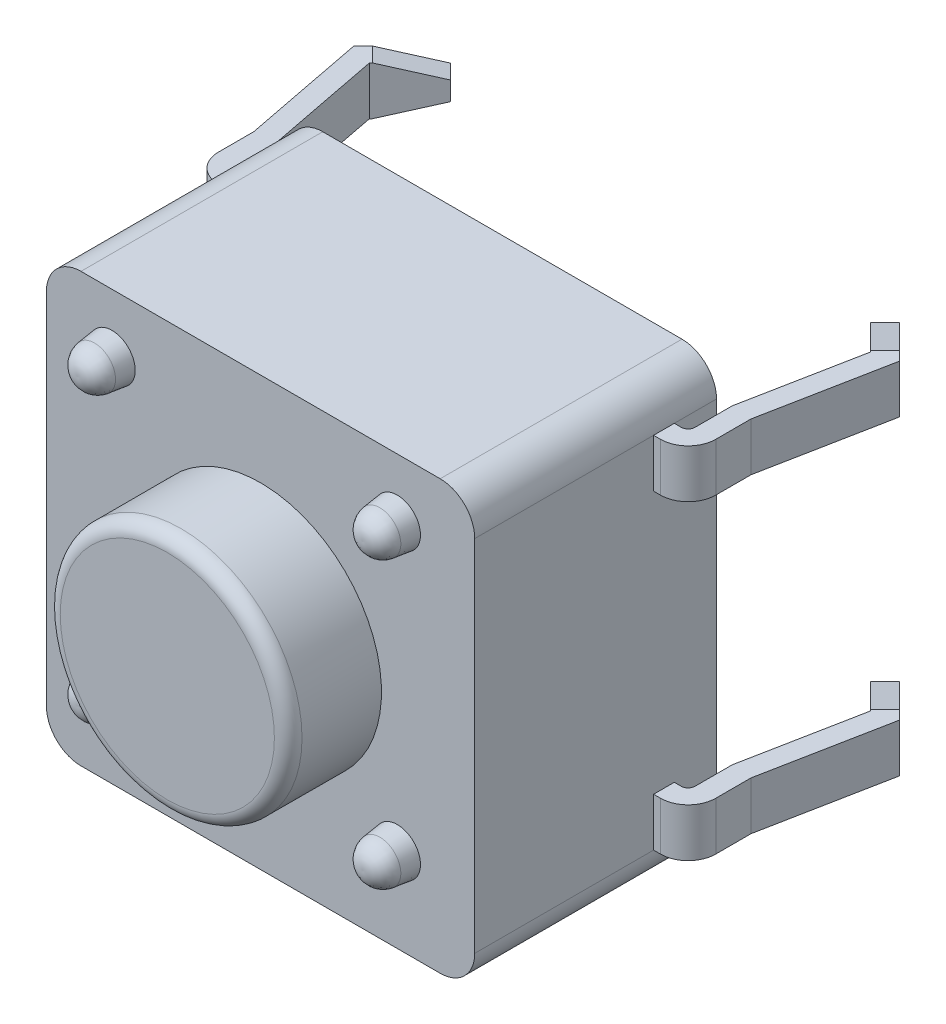
from build123d import *
from OCP.BRepFilletAPI import BRepFilletAPI_MakeChamfer

# Parameters (mm, degrees)
SKETCH1_W                 = 6.2
SKETCH1_H                 = 6.2
EXTRUDE1_DEPTH            = 3.5
SKETCH2_R                 = 1.75
EXTRUDE2_DEPTH            = 1.35
LPATTERN1_COUNT           = 2
LPATTERN1_PITCH           = 4.13
LPATTERN1_COUNT_DIR2      = 2
LPATTERN1_PITCH_DIR2      = 4.13
FILLET1_R                 = 0.5
FILLET2_R                 = 0.2
EXTRUDE3_DEPTH            = 0.35
CHAMFER1_SIZE             = 0.8
CHAMFER1_SIZE2            = 0.214359354
CHAMFER1_OF_MIRROR1_SIZE  = 0.8
CHAMFER1_OF_MIRROR1_SIZE2 = 0.214359354
MIRROR2_START             = -2.6
MIRROR2_DEPTH             = 0.7
MIRROR2_START_2           = 1.9
MIRROR2_2_DEPTH           = 0.7
MIRROR2_START_3           = 3.765863992
MIRROR2_3_DEPTH           = 0.3


with BuildPart() as part:
    # Sketch1 → Extrude1 (new body)
    with BuildSketch(Plane.XY):
        Rectangle(SKETCH1_W, SKETCH1_H)
    extrude(amount=EXTRUDE1_DEPTH)

    # Sketch2 → Extrude2 (add)
    with BuildSketch(Plane.XY.offset(3.5)):
        with Locations(Location((0, 0, 0), (0, 0, 180))):
            Circle(SKETCH2_R)
    extrude(amount=EXTRUDE2_DEPTH)

    # Sketch4 → Revolve1 (revolve)
    with BuildSketch(Plane(origin=(0, 2.25, 0), x_dir=(-1, 0, 0), z_dir=(0, 1, 0)), mode=Mode.PRIVATE) as revolve1_sk:
        with BuildLine():
            Line((1.815270458, 3.5), (2.15, 3.5))
            Line((2.15, 3.5), (2.15, 4))
            ThreePointArc((2.15, 4), (1.948488877, 3.937944347), (1.846391659, 3.753461841))
            Line((1.846391659, 3.753461841), (1.815270458, 3.5))
        make_face()
    revolve1 = revolve(revolve1_sk.sketch.rotate(Axis((-2.15, 2.25, 2.844368125), (0, 0, 1)), 180), axis=Axis((-2.15, 2.25, 2.844368125), (0, 0, 1)))

    # LPattern1: Revolve1 2 × 2
    with Locations(*[(i * LPATTERN1_PITCH, -j * LPATTERN1_PITCH_DIR2, 0) for i in range(LPATTERN1_COUNT) for j in range(LPATTERN1_COUNT_DIR2) if (i, j) != (0, 0)]):
        add(revolve1)

    # Fillet1
    fillet1_edges = [part.edges().sort_by_distance(p)[0] for p in [
        (-3.1, 3.1, 1.75),
        (3.1, 3.1, 1.75),
        (3.1, -3.1, 1.75),
        (-3.1, -3.1, 1.75),
    ]]
    fillet(fillet1_edges, radius=FILLET1_R)

    # Fillet2
    fillet2_edges = [part.edges().sort_by_distance(p)[0] for p in [
        (1.75, 0, 4.85),
    ]]
    fillet(fillet2_edges, radius=FILLET2_R)

    # Sketch5 → Extrude3 (add, symmetric)
    with BuildSketch(Plane(origin=(0, 2.25, 0), x_dir=(-1, 0, 0), z_dir=(0, 1, 0))):
        with BuildLine():
            Line((3.1, 0.91088803), (3.2, 0.91088803))
            ThreePointArc((3.2, 0.91088803), (3.482842712, 0.793730742), (3.6, 0.51088803))
            Line((3.6, 0.51088803), (3.6, 0))
            Line((3.6, 0), (3.95, -1.8))
            Line((3.95, -1.8), (3.25, -2.5))
            Line((3.25, -2.5), (3.037867966, -2.287867966))
            Line((3.037867966, -2.287867966), (3.625066954, -1.700668977))
            Line((3.625066954, -1.700668977), (3.3, -0.02889607))
            Line((3.3, -0.02889607), (3.3, 0.51088803))
            ThreePointArc((3.3, 0.51088803), (3.270710678, 0.581598708), (3.2, 0.61088803))
            Line((3.2, 0.61088803), (3.1, 0.61088803))
            Line((3.1, 0.61088803), (3.1, 0.91088803))
        make_face()
    extrude3 = extrude(amount=EXTRUDE3_DEPTH, both=True)

    # Chamfer1: one chamfer whose edges measure the first distance from different faces: ONE call of the kernel's chamfer builder (chamfer() names one face for all edges)
    chamfer1_edges_1 = [part.edges().sort_by_distance(p)[0] for p in [
        (-3.143933983, 1.9, -2.393933983),
    ]]
    chamfer1_side_1 = [part.faces().sort_by_distance(p)[0] for p in [
        (-3.520562137, 1.9, -0.80393009),
    ]]
    chamfer1_edges_2 = [part.edges().sort_by_distance(p)[0] for p in [
        (-3.143933983, 2.6, -2.393933983),
    ]]
    chamfer1_side_2 = [part.faces().sort_by_distance(p)[0] for p in [
        (-3.520562137, 2.6, -0.80393009),
    ]]
    chamfer1 = BRepFilletAPI_MakeChamfer(part.part.solid().wrapped)
    for e in chamfer1_edges_1:
        chamfer1.Add(CHAMFER1_SIZE, CHAMFER1_SIZE2, e.wrapped, chamfer1_side_1[0].wrapped)  # the first distance lies on this face
    for e in chamfer1_edges_2:
        chamfer1.Add(CHAMFER1_SIZE, CHAMFER1_SIZE2, e.wrapped, chamfer1_side_2[0].wrapped)  # the first distance lies on this face
    add(Compound.cast(chamfer1.Shape()), mode=Mode.REPLACE)

    # Mirror1: Extrude3 across plane
    add(extrude3.mirror(Plane.ZX))

    # Chamfer1 of Mirror1: one chamfer whose edges measure the first distance from different faces: ONE call of the kernel's chamfer builder (chamfer() names one face for all edges)
    chamfer1_of_mirror1_edges_1 = [part.edges().sort_by_distance(p)[0] for p in [
        (-3.143933983, -1.9, -2.393933983),
    ]]
    chamfer1_of_mirror1_side_1 = [part.faces().sort_by_distance(p)[0] for p in [
        (-3.520562137, -1.9, -0.80393009),
    ]]
    chamfer1_of_mirror1_edges_2 = [part.edges().sort_by_distance(p)[0] for p in [
        (-3.143933983, -2.6, -2.393933983),
    ]]
    chamfer1_of_mirror1_side_2 = [part.faces().sort_by_distance(p)[0] for p in [
        (-3.520562137, -2.6, -0.80393009),
    ]]
    chamfer1_of_mirror1 = BRepFilletAPI_MakeChamfer(part.part.solid().wrapped)
    for e in chamfer1_of_mirror1_edges_1:
        chamfer1_of_mirror1.Add(CHAMFER1_OF_MIRROR1_SIZE, CHAMFER1_OF_MIRROR1_SIZE2, e.wrapped, chamfer1_of_mirror1_side_1[0].wrapped)  # the first distance lies on this face
    for e in chamfer1_of_mirror1_edges_2:
        chamfer1_of_mirror1.Add(CHAMFER1_OF_MIRROR1_SIZE, CHAMFER1_OF_MIRROR1_SIZE2, e.wrapped, chamfer1_of_mirror1_side_2[0].wrapped)  # the first distance lies on this face
    add(Compound.cast(chamfer1_of_mirror1.Shape()), mode=Mode.REPLACE)

    # Mirror2: read off the stored shape, not the designer's step
    # Mirror2 outline → Mirror2 (add)
    with BuildSketch(Plane(origin=(0, 0, 0), x_dir=(1, 0, 0), z_dir=(0, 1, 0)).offset(MIRROR2_START)):
        with BuildLine():
            ThreePointArc((3.3, -0.51088803), (3.270710678, -0.581598708), (3.2, -0.61088803))
            Line((3.2, -0.61088803), (3.1, -0.61088803))
            Line((3.1, -0.61088803), (3.1, -0.91088803))
            Line((3.1, -0.91088803), (3.2, -0.91088803))
            ThreePointArc((3.2, -0.91088803), (3.482842712, -0.793730742), (3.6, -0.51088803))
            Line((3.6, -0.51088803), (3.6, 0))
            Line((3.6, 0), (3.95, 1.8))
            Line((3.95, 1.8), (3.25, 2.5))
            Line((3.25, 2.5), (3.037867966, 2.287867966))
            Line((3.037867966, 2.287867966), (3.625066954, 1.700668977))
            Line((3.625066954, 1.700668977), (3.3, 0.02889607))
            Line((3.3, 0.02889607), (3.3, -0.51088803))
        make_face()
    extrude(amount=MIRROR2_DEPTH)

    # Mirror2 2 outline → Mirror2 2 (add)
    with BuildSketch(Plane(origin=(0, 0, 0), x_dir=(1, 0, 0), z_dir=(0, 1, 0)).offset(MIRROR2_START_2)):
        with BuildLine():
            ThreePointArc((3.3, -0.51088803), (3.270710678, -0.581598708), (3.2, -0.61088803))
            Line((3.2, -0.61088803), (3.1, -0.61088803))
            Line((3.1, -0.61088803), (3.1, -0.91088803))
            Line((3.1, -0.91088803), (3.2, -0.91088803))
            ThreePointArc((3.2, -0.91088803), (3.482842712, -0.793730742), (3.6, -0.51088803))
            Line((3.6, -0.51088803), (3.6, 0))
            Line((3.6, 0), (3.95, 1.8))
            Line((3.95, 1.8), (3.25, 2.5))
            Line((3.25, 2.5), (3.037867966, 2.287867966))
            Line((3.037867966, 2.287867966), (3.625066954, 1.700668977))
            Line((3.625066954, 1.700668977), (3.3, 0.02889607))
            Line((3.3, 0.02889607), (3.3, -0.51088803))
        make_face()
    extrude(amount=MIRROR2_2_DEPTH)

    # Mirror2 3 outline → Mirror2 3 (cut)
    with BuildSketch(Plane(origin=(0, 0, 0), x_dir=(0.7071067811865487, 0, 0.7071067811865464), z_dir=(0.7071067811865465, 0, -0.7071067811865485)).offset(MIRROR2_START_3)):
        Polygon((0.530330086, -2.6), (1.330330086, -2.6), (0.530330086, -2.385640646), align=None)
        Polygon((0.530330086, -1.9), (0.530330086, -2.114359354), (1.330330086, -1.9), align=None)
        Polygon((1.330330086, 1.9), (0.530330086, 2.114359354), (0.530330086, 1.9), align=None)
        Polygon((0.530330086, 2.385640646), (1.330330086, 2.6), (0.530330086, 2.6), align=None)
    extrude(amount=MIRROR2_3_DEPTH, mode=Mode.SUBTRACT)


solid = part.part
